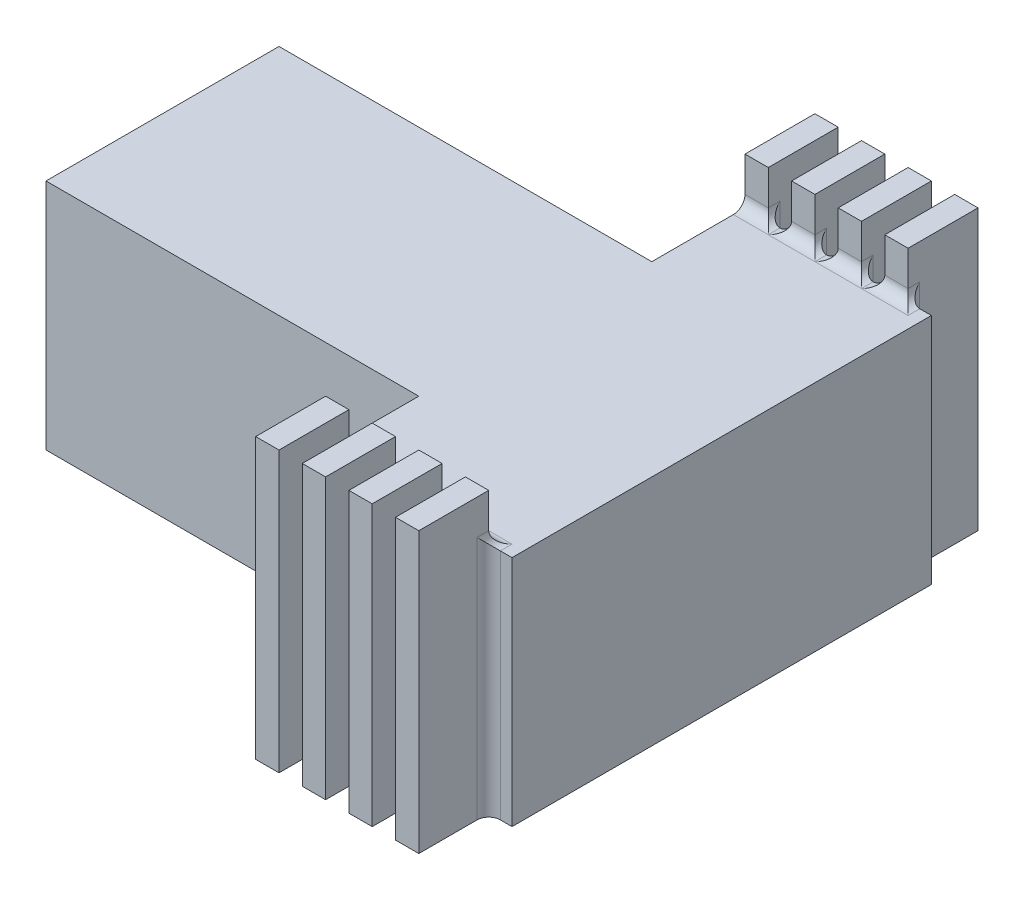
from build123d import *

# Parameters (mm, degrees)
BOSS_EXTRUDE1_DEPTH             = 50
SKETCH2_W                       = 5
SKETCH2_H                       = 15
BOSS_EXTRUDE2_DEPTH             = 10
BOSS_EXTRUDE2_DIRECTION_2_REACH = 149.648
FILLET1_R                       = 2.5
FILLET2_R                       = 2.5
FILLET4_R                       = 2.5


with BuildPart() as part:
    # Sketch1 → Boss-Extrude1 (new body)
    with BuildSketch(Plane(origin=(0, 0, 0), x_dir=(1, 0, 0), z_dir=(0, 1, 0))):
        Polygon((80, 50), (80, 70), (120, 70), (120, -20), (80, -20), (80, 0), (0, 0), (0, 50), align=None)
    extrude(amount=BOSS_EXTRUDE1_DEPTH)

    # Sketch2 → Boss-Extrude2 (add)
    with BuildSketch(Plane(origin=(0, 50, 0), x_dir=(1, 0, 0), z_dir=(0, 1, 0))):
        with Locations((82.5, -27.5)):
            Rectangle(SKETCH2_W, SKETCH2_H)
        with Locations((92.5, -27.5)):
            Rectangle(SKETCH2_W, SKETCH2_H)
        with Locations((102.5, -27.5)):
            Rectangle(SKETCH2_W, SKETCH2_H)
        with Locations((112.5, -27.5)):
            Rectangle(SKETCH2_W, SKETCH2_H)
        with Locations((112.5, 77.5)):
            Rectangle(SKETCH2_W, SKETCH2_H)
        with Locations((102.5, 77.5)):
            Rectangle(SKETCH2_W, SKETCH2_H)
        with Locations((92.5, 77.5)):
            Rectangle(SKETCH2_W, SKETCH2_H)
        with Locations((82.5, 77.5)):
            Rectangle(SKETCH2_W, SKETCH2_H)
    extrude(amount=BOSS_EXTRUDE2_DEPTH)

    # Boss-Extrude2 direction 2: up to this face of the body (flat: up to its plane)
    boss_extrude2_direction_2_end = Plane(part.part.faces().sort_by_distance((68.421052632, 0, -25))[0])
    # Sketch2 → Boss-Extrude2 direction 2 (add, up to the picked face)
    with BuildSketch(Plane(origin=(0, 50, 0), x_dir=(1, 0, 0), z_dir=(0, 1, 0)), mode=Mode.PRIVATE) as boss_extrude2_direction_2_sk1:
        with Locations((82.5, -27.5)):
            Rectangle(SKETCH2_W, SKETCH2_H)
    boss_extrude2_direction_2_tool1 = split(extrude(boss_extrude2_direction_2_sk1.sketch, amount=-BOSS_EXTRUDE2_DIRECTION_2_REACH, mode=Mode.PRIVATE), bisect_by=boss_extrude2_direction_2_end, keep=Keep.BOTH, mode=Mode.PRIVATE)
    # Sketch2 → Boss-Extrude2 direction 2 (add, up to the picked face)
    with BuildSketch(Plane(origin=(0, 50, 0), x_dir=(1, 0, 0), z_dir=(0, 1, 0)), mode=Mode.PRIVATE) as boss_extrude2_direction_2_sk2:
        with Locations((92.5, -27.5)):
            Rectangle(SKETCH2_W, SKETCH2_H)
    boss_extrude2_direction_2_tool2 = split(extrude(boss_extrude2_direction_2_sk2.sketch, amount=-BOSS_EXTRUDE2_DIRECTION_2_REACH, mode=Mode.PRIVATE), bisect_by=boss_extrude2_direction_2_end, keep=Keep.BOTH, mode=Mode.PRIVATE)
    # Sketch2 → Boss-Extrude2 direction 2 (add, up to the picked face)
    with BuildSketch(Plane(origin=(0, 50, 0), x_dir=(1, 0, 0), z_dir=(0, 1, 0)), mode=Mode.PRIVATE) as boss_extrude2_direction_2_sk3:
        with Locations((102.5, -27.5)):
            Rectangle(SKETCH2_W, SKETCH2_H)
    boss_extrude2_direction_2_tool3 = split(extrude(boss_extrude2_direction_2_sk3.sketch, amount=-BOSS_EXTRUDE2_DIRECTION_2_REACH, mode=Mode.PRIVATE), bisect_by=boss_extrude2_direction_2_end, keep=Keep.BOTH, mode=Mode.PRIVATE)
    # Sketch2 → Boss-Extrude2 direction 2 (add, up to the picked face)
    with BuildSketch(Plane(origin=(0, 50, 0), x_dir=(1, 0, 0), z_dir=(0, 1, 0)), mode=Mode.PRIVATE) as boss_extrude2_direction_2_sk4:
        with Locations((112.5, -27.5)):
            Rectangle(SKETCH2_W, SKETCH2_H)
    boss_extrude2_direction_2_tool4 = split(extrude(boss_extrude2_direction_2_sk4.sketch, amount=-BOSS_EXTRUDE2_DIRECTION_2_REACH, mode=Mode.PRIVATE), bisect_by=boss_extrude2_direction_2_end, keep=Keep.BOTH, mode=Mode.PRIVATE)
    # Sketch2 → Boss-Extrude2 direction 2 (add, up to the picked face)
    with BuildSketch(Plane(origin=(0, 50, 0), x_dir=(1, 0, 0), z_dir=(0, 1, 0)), mode=Mode.PRIVATE) as boss_extrude2_direction_2_sk5:
        with Locations((112.5, 77.5)):
            Rectangle(SKETCH2_W, SKETCH2_H)
    boss_extrude2_direction_2_tool5 = split(extrude(boss_extrude2_direction_2_sk5.sketch, amount=-BOSS_EXTRUDE2_DIRECTION_2_REACH, mode=Mode.PRIVATE), bisect_by=boss_extrude2_direction_2_end, keep=Keep.BOTH, mode=Mode.PRIVATE)
    # Sketch2 → Boss-Extrude2 direction 2 (add, up to the picked face)
    with BuildSketch(Plane(origin=(0, 50, 0), x_dir=(1, 0, 0), z_dir=(0, 1, 0)), mode=Mode.PRIVATE) as boss_extrude2_direction_2_sk6:
        with Locations((102.5, 77.5)):
            Rectangle(SKETCH2_W, SKETCH2_H)
    boss_extrude2_direction_2_tool6 = split(extrude(boss_extrude2_direction_2_sk6.sketch, amount=-BOSS_EXTRUDE2_DIRECTION_2_REACH, mode=Mode.PRIVATE), bisect_by=boss_extrude2_direction_2_end, keep=Keep.BOTH, mode=Mode.PRIVATE)
    # Sketch2 → Boss-Extrude2 direction 2 (add, up to the picked face)
    with BuildSketch(Plane(origin=(0, 50, 0), x_dir=(1, 0, 0), z_dir=(0, 1, 0)), mode=Mode.PRIVATE) as boss_extrude2_direction_2_sk7:
        with Locations((92.5, 77.5)):
            Rectangle(SKETCH2_W, SKETCH2_H)
    boss_extrude2_direction_2_tool7 = split(extrude(boss_extrude2_direction_2_sk7.sketch, amount=-BOSS_EXTRUDE2_DIRECTION_2_REACH, mode=Mode.PRIVATE), bisect_by=boss_extrude2_direction_2_end, keep=Keep.BOTH, mode=Mode.PRIVATE)
    # Sketch2 → Boss-Extrude2 direction 2 (add, up to the picked face)
    with BuildSketch(Plane(origin=(0, 50, 0), x_dir=(1, 0, 0), z_dir=(0, 1, 0)), mode=Mode.PRIVATE) as boss_extrude2_direction_2_sk8:
        with Locations((82.5, 77.5)):
            Rectangle(SKETCH2_W, SKETCH2_H)
    boss_extrude2_direction_2_tool8 = split(extrude(boss_extrude2_direction_2_sk8.sketch, amount=-BOSS_EXTRUDE2_DIRECTION_2_REACH, mode=Mode.PRIVATE), bisect_by=boss_extrude2_direction_2_end, keep=Keep.BOTH, mode=Mode.PRIVATE)
    add(boss_extrude2_direction_2_tool1.solids().sort_by(Axis((82.5, 50, 27.5), (0, -1, 0)))[0])
    add(boss_extrude2_direction_2_tool2.solids().sort_by(Axis((92.5, 50, 27.5), (0, -1, 0)))[0])
    add(boss_extrude2_direction_2_tool3.solids().sort_by(Axis((102.5, 50, 27.5), (0, -1, 0)))[0])
    add(boss_extrude2_direction_2_tool4.solids().sort_by(Axis((112.5, 50, 27.5), (0, -1, 0)))[0])
    add(boss_extrude2_direction_2_tool5.solids().sort_by(Axis((112.5, 50, -77.5), (0, -1, 0)))[0])
    add(boss_extrude2_direction_2_tool6.solids().sort_by(Axis((102.5, 50, -77.5), (0, -1, 0)))[0])
    add(boss_extrude2_direction_2_tool7.solids().sort_by(Axis((92.5, 50, -77.5), (0, -1, 0)))[0])
    add(boss_extrude2_direction_2_tool8.solids().sort_by(Axis((82.5, 50, -77.5), (0, -1, 0)))[0])

    # Fillet1
    fillet1_edges = [part.edges().sort_by_distance(p)[0] for p in [
        (85, 25, -70),
        (85, 25, 20),
        (115, 25, -70),
        (110, 25, -70),
        (95, 25, 20),
        (90, 25, 20),
        (105, 25, 20),
        (100, 25, 20),
        (115, 25, 20),
        (110, 25, 20),
        (105, 25, -70),
        (100, 25, -70),
        (95, 25, -70),
        (90, 25, -70),
    ]]
    fillet(fillet1_edges, radius=FILLET1_R - 0.0001)  # a hair under: the kernel refuses the full size

    # Fillet2
    fillet2_edges = [part.edges().sort_by_distance(p)[0] for p in [
        (82.5, 50, -70),
        (82.5, 50, 20),
        (112.5, 50, -70),
        (92.5, 50, 20),
        (102.5, 50, 20),
        (112.5, 50, 20),
        (102.5, 50, -70),
        (92.5, 50, -70),
    ]]
    fillet(fillet2_edges, radius=FILLET2_R)

    # Fillet4
    fillet4_edges = [part.edges().sort_by_distance(p)[0] for p in [
        (110, 50, -69.99995),
        (100, 50, -69.99995),
        (90, 50, -69.99995),
        (110, 50, 19.99995),
        (100, 50, 19.99995),
        (90, 50, 19.99995),
        (115, 50, -69.99995),
        (105, 50, -69.99995),
        (95, 50, -69.99995),
        (85, 50, -69.99995),
        (85, 50, 19.99995),
        (95, 50, 19.99995),
        (105, 50, 19.99995),
        (115, 50, 19.99995),
    ]]
    fillet(fillet4_edges, radius=FILLET4_R - 0.0001)  # a hair under: the kernel refuses the full size


solid = part.part
